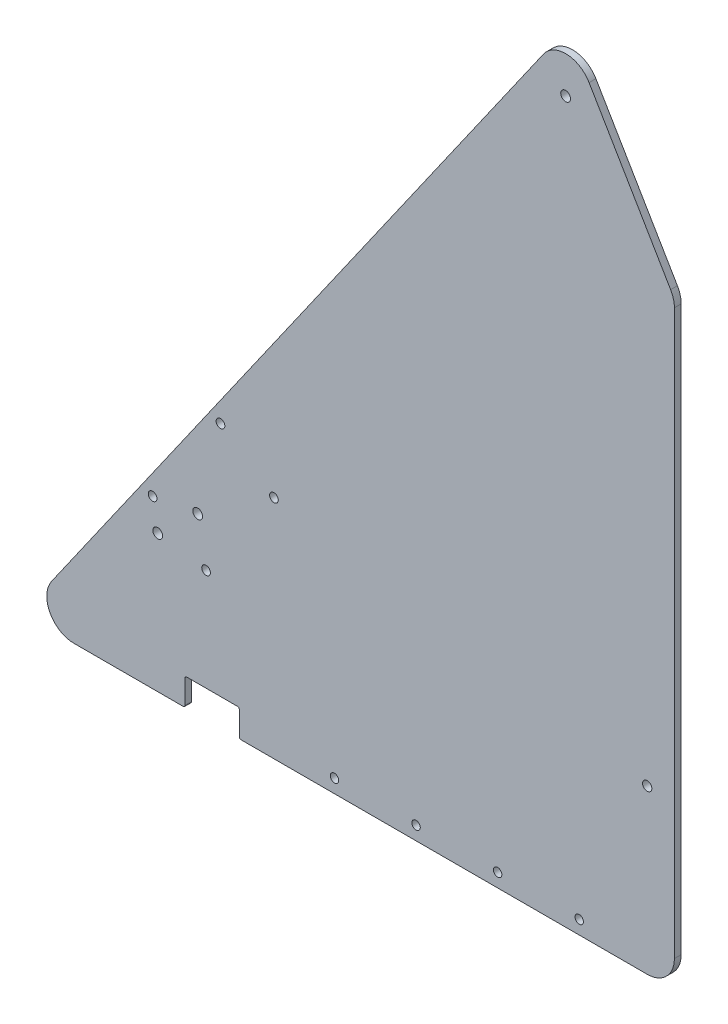
from build123d import *

# Parameters (mm, degrees)
BOSS_EXTRUDE1_DEPTH = 3.175
SKETCH2_R           = 2.286
SKETCH2_R_2         = 2.159
SKETCH2_R_3         = 1.96820932
SKETCH2_R_4         = 2.032
CUT_EXTRUDE1_DEPTH  = 475.859409022
FILLET1_R           = 12.7
FILLET2_R           = 0.79375


with BuildPart() as part:
    # Sketch1 → Boss-Extrude1 (new body)
    with BuildSketch(Plane.XY):
        Polygon((0, 0), (76.2, 0), (76.2, 12.7), (101.6, 12.7), (101.6, 0), (304.8, 0), (304.8, 279.4), (254.954725958, 364.113083686), align=None)
    extrude(amount=BOSS_EXTRUDE1_DEPTH)

    # Sketch2 → Cut-Extrude1 (cut, through all)
    with BuildSketch(Plane.XY.offset(3.175)):
        with Locations((63.5, 64.117269263)):
            Circle(SKETCH2_R)
        with Locations((254, 336.179464547)):
            Circle(SKETCH2_R)
        with Locations((82.157477841, 81.352654974)):
            Circle(SKETCH2_R)
        with Locations((292.1, 76.2)):
            Circle(SKETCH2_R_2)
        with Locations((184.15, 6.35)):
            Circle(SKETCH2_R_3)
        with Locations((222.25, 6.35)):
            Circle(SKETCH2_R_3)
        with Locations((260.35, 6.35)):
            Circle(SKETCH2_R_3)
        with Locations((92.801636541, 123.124218169)):
            Circle(SKETCH2_R_4)
        with Locations((61.114406315, 77.870163483)):
            Circle(SKETCH2_R_4)
        with Locations((86.082160625, 60.387553703)):
            Circle(SKETCH2_R_4)
        with Locations((117.769390851, 105.641608389)):
            Circle(SKETCH2_R_4)
        with Locations((146.05, 6.35)):
            Circle(SKETCH2_R_3)
    extrude(amount=-CUT_EXTRUDE1_DEPTH, mode=Mode.SUBTRACT)

    # Fillet1
    fillet1_edges = [part.edges().sort_by_distance(p)[0] for p in [
        (0, 0, 1.5875),
        (304.8, 0, 1.5875),
        (304.8, 279.4, 1.5875),
        (254.954725958, 364.113083686, 1.5875),
    ]]
    fillet(fillet1_edges, radius=FILLET1_R)

    # Fillet2
    fillet2_edges = [part.edges().sort_by_distance(p)[0] for p in [
        (101.6, 0, 1.5875),
        (101.6, 12.7, 1.5875),
        (76.2, 0, 1.5875),
        (76.2, 12.7, 1.5875),
    ]]
    fillet(fillet2_edges, radius=FILLET2_R)


solid = part.part
